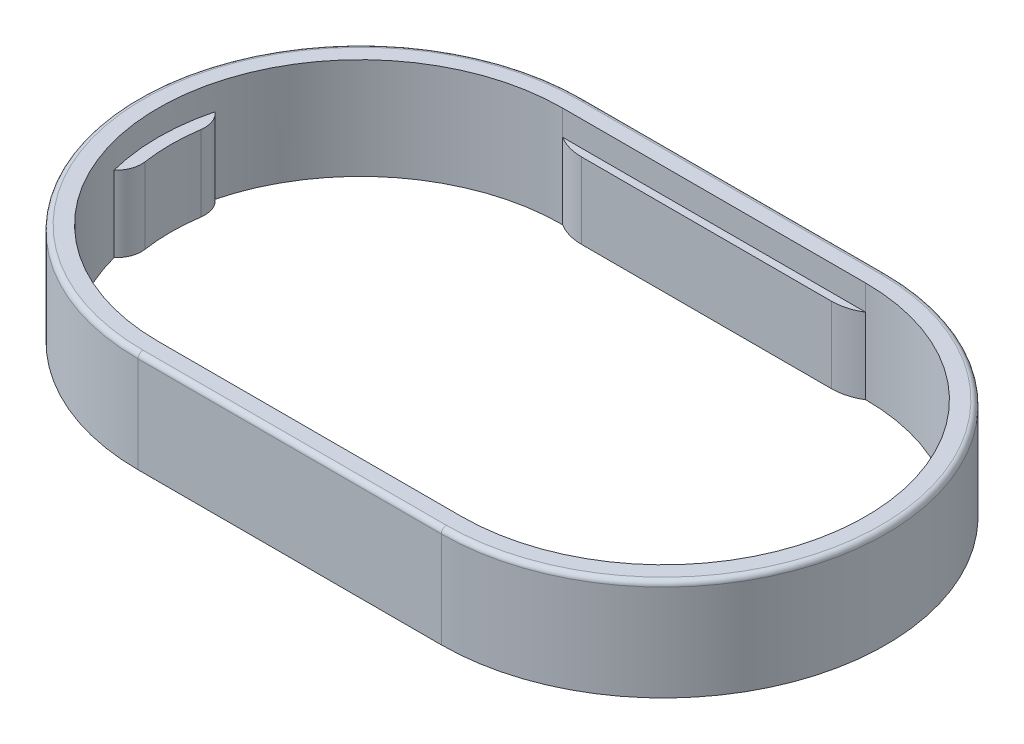
from build123d import *

# Parameters (mm, degrees)
BOSS_EXTRUDE1_DEPTH = 20
SHELL1_T            = -4
SKETCH3_W           = 60
SKETCH3_H           = 1.5
BOSS_EXTRUDE2_DEPTH = 15
BOSS_EXTRUDE3_DEPTH = 15
FILLET2_R           = 10
BOSS_EXTRUDE5_DEPTH = 15
FILLET5_R           = 5
FILLET6_R           = 1
SKETCH7_R           = 1
CUT_EXTRUDE1_DEPTH  = 3


with BuildPart() as part:
    # Sketch1 → Boss-Extrude1 (new body)
    with BuildSketch(Plane(origin=(0, 0, 0), x_dir=(1, 0, 0), z_dir=(0, 1, 0))):
        with BuildLine():
            Line((0, 0), (60, 0))
            ThreePointArc((60, 0), (104, 44), (60, 88))
            Line((60, 88), (0, 88))
            ThreePointArc((0, 88), (-44, 44), (0, 0))
        make_face()
    extrude(amount=BOSS_EXTRUDE1_DEPTH)

    # Shell1
    shell1_openings = [part.faces().sort_by_distance(p)[0] for p in [
        (30, 20, -44),
        (30, 0, -44),
    ]]
    offset(amount=SHELL1_T, openings=shell1_openings, kind=Kind.INTERSECTION)

    # Sketch3 → Boss-Extrude2 (add)
    with BuildSketch(Plane.XZ):
        with Locations((30, -4.75)):
            Rectangle(SKETCH3_W, SKETCH3_H)
    extrude(amount=-BOSS_EXTRUDE2_DEPTH)

    # Sketch5 → Boss-Extrude3 (add)
    with BuildSketch(Plane.XZ):
        Polygon((0, -84), (0, -82.5), (60.003782522, -82.5), (60, -84), align=None)
    extrude(amount=-BOSS_EXTRUDE3_DEPTH)

    # Fillet2
    # the kernel refuses this fillet: 10 mm, written as the material it takes off along each edge
    with BuildSketch(Plane(origin=(60, -13.169567191, -5.5), x_dir=(0, 0, 1), z_dir=(0, 1, 0)), Plane(origin=(0, -13.169567191, -82.5), x_dir=(0, 0, -1), z_dir=(0, 1, 0))) as fillet2_piece_1:
        with BuildLine():
            CenterArc((10, -5.267826876), FILLET2_R, 148.211669383, 31.788330617)
            Line((0, -5.267826876), (-0.2, -5.267826876))
            Line((-0.2, -5.267826876), (-0.2, 0))
            Line((-0.2, 0), (0, 0.2))
            ThreePointArc((0, 0.2), (0.75, 0.2), (1.33, 0.105356538))
            Line((1.33, 0.105356538), (1.5, 0))
        make_face()
    extrude(amount=41.339134382, mode=Mode.SUBTRACT)
    with BuildSketch(Plane(origin=(60.003782522, -13.179023495, -82.5), x_dir=(-1, 0, 0), z_dir=(0, 1, 0))) as fillet2_piece_2:
        with BuildLine():
            CenterArc((5.271609398, -10), FILLET2_R, 90, 31.788330617)
            Line((0.003782522, -1.5), (-0.101574016, -1.33))
            ThreePointArc((-0.101574016, -1.33), (-0.198108103, -0.750504335), (-0.199999364, -0.000504335))
            Line((-0.199999364, -0.000504335), (0, 0.2))
            Line((0, 0.2), (5.271609398, 0.2))
            Line((5.271609398, 0.2), (5.271609398, 0))
        make_face()
    extrude(amount=41.358046991, mode=Mode.SUBTRACT)
    with BuildSketch(Plane(origin=(0, -13.169567191, -5.5), x_dir=(1, 0, 0), z_dir=(0, 1, 0))) as fillet2_piece_3:
        with BuildLine():
            CenterArc((5.267826876, -10), FILLET2_R, 90, 31.788330617)
            Line((0, -1.5), (-0.105356538, -1.33))
            ThreePointArc((-0.105356538, -1.33), (-0.2, -0.75), (-0.2, 0))
            Line((-0.2, 0), (0, 0.2))
            Line((0, 0.2), (5.267826876, 0.2))
            Line((5.267826876, 0.2), (5.267826876, 0))
        make_face()
    extrude(amount=41.339134382, mode=Mode.SUBTRACT)

    # Sketch8 → Boss-Extrude5 (add)
    with BuildSketch(Plane.XZ):
        with BuildLine():
            Line((96.142080737, -34), (98.729833462, -34))
            ThreePointArc((98.729833462, -34), (100, -44), (98.729833462, -54))
            Line((98.729833462, -54), (96.142080737, -54))
            ThreePointArc((96.142080737, -54), (97.5, -44), (96.142080737, -34))
        make_face()
        with BuildLine():
            Line((-36.142080737, -54), (-38.729833462, -54))
            ThreePointArc((-38.729833462, -54), (-40, -44), (-38.729833462, -34))
            Line((-38.729833462, -34), (-36.142080737, -34))
            ThreePointArc((-36.142080737, -34), (-37.5, -44), (-36.142080737, -54))
        make_face()
    extrude(amount=-BOSS_EXTRUDE5_DEPTH)

    # Fillet5
    # the kernel refuses this fillet: 5 mm, written as the material it takes off along each edge
    with BuildSketch(Plane(origin=(96.142080737, -11.460527233, -34), x_dir=(1, 0, 0), z_dir=(0, 1, 0)), Plane(origin=(-36.142080737, -11.460527233, -54), x_dir=(-1, 0, 0), z_dir=(0, 1, 0))) as fillet5_piece_1:
        with BuildLine():
            CenterArc((5.895743435, 3.749292929), FILLET5_R, 171.542516957, 57.035612676)
            Line((0.950117062, 4.484670231), (0.851204534, 4.499377777))
            ThreePointArc((0.851204534, 4.499377777), (0.445822951, 2.248528932), (-0.096378882, 0.026666667))
            Line((-0.096378882, 0.026666667), (0, -0.1))
            ThreePointArc((0, -0.1), (1.293876363, -0.1), (2.521592911, -0.074985859))
            Line((2.521592911, -0.074985859), (2.587752725, 0))
        make_face()
    extrude(amount=37.921054465, mode=Mode.SUBTRACT)
    with BuildSketch(Plane(origin=(96.142080737, -11.460527233, -54), x_dir=(1, 0, 0), z_dir=(0, 1, 0)), Plane(origin=(-36.142080737, -11.460527233, -34), x_dir=(-1, 0, 0), z_dir=(0, 1, 0))) as fillet5_piece_2:
        with BuildLine():
            CenterArc((5.895743435, -3.749292929), FILLET5_R, 131.421870366, 57.035612676)
            Line((0.950117062, -4.484670231), (0.851204534, -4.499377777))
            ThreePointArc((0.851204534, -4.499377777), (0.445822951, -2.248528932), (-0.096378882, -0.026666667))
            Line((-0.096378882, -0.026666667), (0, 0.1))
            ThreePointArc((0, 0.1), (1.293876363, 0.1), (2.521592911, 0.074985859))
            Line((2.521592911, 0.074985859), (2.587752725, 0))
        make_face()
    extrude(amount=37.921054465, mode=Mode.SUBTRACT)

    # Fillet6
    fillet6_edges = [part.edges().sort_by_distance(p)[0] for p in [
        (104, 20, -44),
        (30, 20, -88),
        (-44, 20, -44),
        (30, 20, 0),
    ]]
    fillet(fillet6_edges, radius=FILLET6_R)

    # Sketch7 → Cut-Extrude1 (cut)
    with BuildSketch(Plane.XZ):
        with Locations(Location((-42, -44, 0), (0, 0, 270))):
            Circle(SKETCH7_R)
        with Locations(Location((-36.105117767, -22, 0), (0, 0, 270))):
            Circle(SKETCH7_R)
        with Locations(Location((-36.105117767, -66, 0), (0, 0, 90))):
            Circle(SKETCH7_R)
        with Locations(Location((0, -2, 0), (0, 0, 270))):
            Circle(SKETCH7_R)
        with Locations(Location((30, -2, 0), (0, 0, 270))):
            Circle(SKETCH7_R)
        with Locations(Location((0, -86, 0), (0, 0, 270))):
            Circle(SKETCH7_R)
        with Locations(Location((30, -86, 0), (0, 0, 270))):
            Circle(SKETCH7_R)
        with Locations(Location((96.105117767, -22, 0), (0, 0, 90))):
            Circle(SKETCH7_R)
        with Locations(Location((96.105117767, -66, 0), (0, 0, 270))):
            Circle(SKETCH7_R)
        with Locations(Location((60, -86, 0), (0, 0, 90))):
            Circle(SKETCH7_R)
        with Locations(Location((60, -2, 0), (0, 0, 90))):
            Circle(SKETCH7_R)
    extrude(amount=-CUT_EXTRUDE1_DEPTH, mode=Mode.SUBTRACT)


solid = part.part
